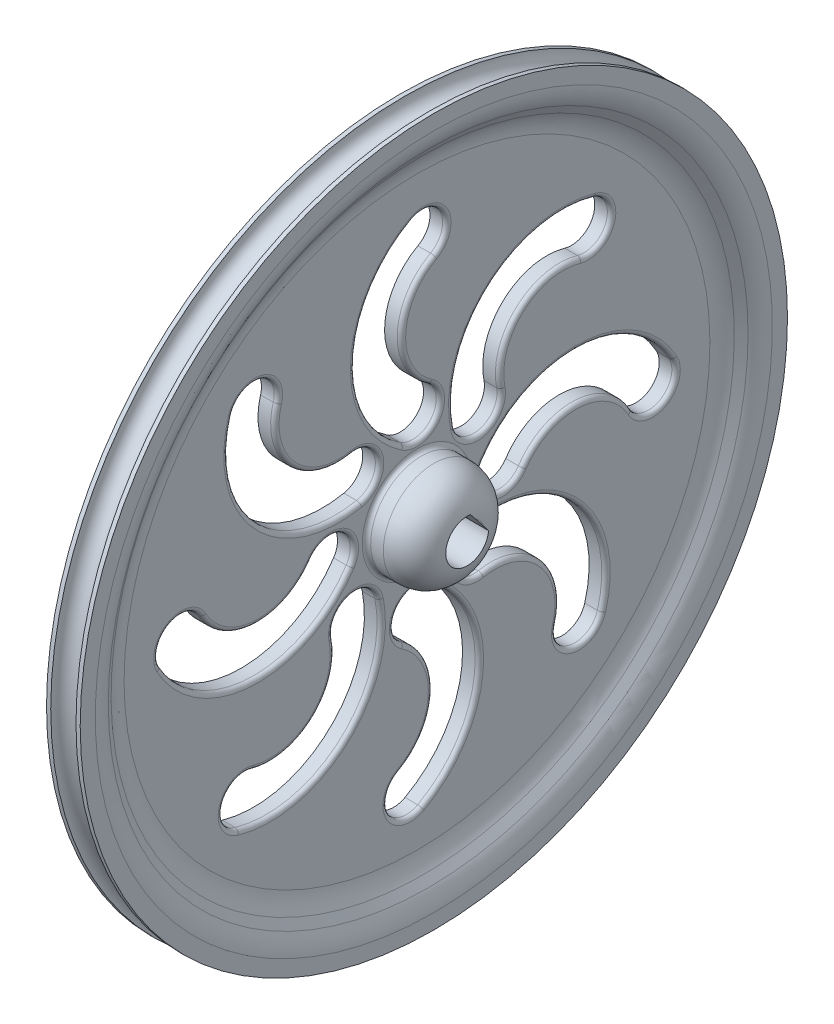
from build123d import *

# Parameters (mm, degrees)
WYTNIJ_WYCI_GNI_CIE8_DEPTH = 70.489061928
WYTNIJ_WYCI_GNI_CIE9_DEPTH = 70.287298459
ZAOKR_GLENIE1_R            = 4
ZAOKR_GLENIE2_R            = 0.5


with BuildPart() as part:
    # Szkic1 → Obrót1 (revolve)
    with BuildSketch(Plane.XY):
        with BuildLine():
            Line((6, -12.778916817), (-2, -12.778916817))
            Line((-2, -12.778916817), (-2, 29.221083183))
            Line((-2, 29.221083183), (-1.5, 29.221083183))
            ThreePointArc((-1.5, 29.221083183), (0, 27.721083183), (1.5, 29.221083183))
            Line((1.5, 29.221083183), (2, 29.221083183))
            Line((2, 29.221083183), (2, 27.432185734))
            ThreePointArc((2, 27.432185734), (1.828368106, 26.273049139), (1.328201177, 25.213384949))
            Line((1.328201177, 25.213384949), (0.671798823, 24.228781417))
            ThreePointArc((0.671798823, 24.228781417), (0.171631894, 23.169117227), (0, 22.009980632))
            Line((0, 22.009980632), (0, -6.778916817))
            Line((0, -6.778916817), (6, -6.778916817))
            Line((6, -6.778916817), (6, -12.778916817))
        make_face()
    revolve(axis=Axis((6, -12.778916817, 0), (-1, 0, 0)))

    # Szkic4 → Wytnij-wyciągnięcie8 (cut, through all)
    with BuildSketch(Plane(origin=(6, 0, 0), x_dir=(0, 0, -1), z_dir=(1, 0, 0))):
        with BuildLine():
            Line((0.380948258, -10.257532589), (2.541219296, -12.990351177))
            ThreePointArc((2.541219296, -12.990351177), (-2.000459988, -14.360264293), (0.380948258, -10.257532589))
        make_face()
    extrude(amount=-WYTNIJ_WYCI_GNI_CIE8_DEPTH, mode=Mode.SUBTRACT)

    # Szkic5 → Wytnij-wyciągnięcie9 (cut, through all)
    with BuildSketch(Plane(origin=(0, 0, 0), x_dir=(0, 0, -1), z_dir=(1, 0, 0))):
        with BuildLine():
            ThreePointArc((-0.575720008, 17.423189035), (-7.399578746, 6.437179505), (-1.542690175, -5.093401996))
            ThreePointArc((-1.542690175, -5.093401996), (2.314485179, -4.321606992), (1.542690175, -0.464431639))
            ThreePointArc((1.542690175, -0.464431639), (-1.841704197, 6.198497775), (2.101452451, 12.546747084))
            ThreePointArc((2.101452451, 12.546747084), (3.201087197, 16.323554289), (-0.575720008, 17.423189035))
        make_face()
        with BuildLine():
            ThreePointArc((21.10534775, 8.919538793), (8.511869125, 5.976453744), (4.499962381, -6.318344251))
            ThreePointArc((4.499962381, -6.318344251), (7.77313871, -8.500037619), (9.954832078, -5.22686129))
            ThreePointArc((9.954832078, -5.22686129), (12.273106439, 1.877669493), (19.550229379, 3.578326822))
            ThreePointArc((19.550229379, 3.578326822), (22.99839455, 5.471373622), (21.10534775, 8.919538793))
        make_face()
        with BuildLine():
            ThreePointArc((30.423189035, -12.424279992), (19.437179505, -5.600421254), (7.906598004, -11.457309825))
            ThreePointArc((7.906598004, -11.457309825), (8.678393008, -15.314485179), (12.535568361, -14.542690175))
            ThreePointArc((12.535568361, -14.542690175), (19.198497775, -11.158295803), (25.546747084, -15.101452451))
            ThreePointArc((25.546747084, -15.101452451), (29.323554289, -16.201087197), (30.423189035, -12.424279992))
        make_face()
        with BuildLine():
            ThreePointArc((21.919538793, -34.10534775), (18.976453744, -21.511869125), (6.681655749, -17.499962381))
            ThreePointArc((6.681655749, -17.499962381), (4.499962381, -20.77313871), (7.77313871, -22.954832078))
            ThreePointArc((7.77313871, -22.954832078), (14.877669493, -25.273106439), (16.578326822, -32.550229379))
            ThreePointArc((16.578326822, -32.550229379), (18.471373622, -35.99839455), (21.919538793, -34.10534775))
        make_face()
        with BuildLine():
            ThreePointArc((0.575720008, -43.423189035), (7.399578746, -32.437179505), (1.542690175, -20.906598004))
            ThreePointArc((1.542690175, -20.906598004), (-2.314485179, -21.678393008), (-1.542690175, -25.535568361))
            ThreePointArc((-1.542690175, -25.535568361), (1.841704197, -32.198497775), (-2.101452451, -38.546747084))
            ThreePointArc((-2.101452451, -38.546747084), (-3.201087197, -42.323554289), (0.575720008, -43.423189035))
        make_face()
        with BuildLine():
            ThreePointArc((-21.10534775, -34.919538793), (-8.511869125, -31.976453744), (-4.499962381, -19.681655749))
            ThreePointArc((-4.499962381, -19.681655749), (-7.77313871, -17.499962381), (-9.954832078, -20.77313871))
            ThreePointArc((-9.954832078, -20.77313871), (-12.273106439, -27.877669493), (-19.550229379, -29.578326822))
            ThreePointArc((-19.550229379, -29.578326822), (-22.99839455, -31.471373622), (-21.10534775, -34.919538793))
        make_face()
        with BuildLine():
            ThreePointArc((-30.423189035, -13.575720008), (-19.437179505, -20.399578746), (-7.906598004, -14.542690175))
            ThreePointArc((-7.906598004, -14.542690175), (-8.678393008, -10.685514821), (-12.535568361, -11.457309825))
            ThreePointArc((-12.535568361, -11.457309825), (-19.198497775, -14.841704197), (-25.546747084, -10.898547549))
            ThreePointArc((-25.546747084, -10.898547549), (-29.323554289, -9.798912803), (-30.423189035, -13.575720008))
        make_face()
        with BuildLine():
            ThreePointArc((-21.919538793, 8.10534775), (-18.976453744, -4.488130875), (-6.681655749, -8.500037619))
            ThreePointArc((-6.681655749, -8.500037619), (-4.499962381, -5.22686129), (-7.77313871, -3.045167922))
            ThreePointArc((-7.77313871, -3.045167922), (-14.877669493, -0.726893561), (-16.578326822, 6.550229379))
            ThreePointArc((-16.578326822, 6.550229379), (-18.471373622, 9.99839455), (-21.919538793, 8.10534775))
        make_face()
    extrude(amount=-WYTNIJ_WYCI_GNI_CIE9_DEPTH, mode=Mode.SUBTRACT)

    # Zaokrąglenie1
    # the kernel refuses this fillet: 4 mm, written as the material it takes off along each edge
    with BuildSketch(Plane(origin=(6, -12.778916817, 0), x_dir=(0, 1, 0), z_dir=(0, 0, 1))) as zaokr_glenie1_piece_1:
        with BuildLine():
            CenterArc((6 - ZAOKR_GLENIE1_R, ZAOKR_GLENIE1_R), ZAOKR_GLENIE1_R, 270, 90)
            Line((6, ZAOKR_GLENIE1_R), (6, 0))
            Line((6, 0), (6 - ZAOKR_GLENIE1_R, 0))
        make_face()
    revolve(axis=Axis((6, -12.778916817, 0), (-1, 0, 0)), mode=Mode.SUBTRACT)

    # Zaokrąglenie2
    zaokr_glenie2_edges = [part.edges().sort_by_distance(p)[0] for p in [
        (0, -31.471373622, 22.99839455),
        (0, -31.976453744, 8.511869125),
        (0, -17.499962381, 7.77313871),
        (0, -27.877669493, 12.273106439),
        (0, -9.798912803, 29.323554289),
        (0, -20.399578746, 19.437179505),
        (0, -10.685514821, 8.678393008),
        (0, -14.841704197, 19.198497775),
        (0, 9.99839455, 18.471373622),
        (0, -4.488130875, 18.976453744),
        (0, -5.22686129, 4.499962381),
        (0, -0.726893561, 14.877669493),
        (0, 16.323554289, -3.201087197),
        (0, 6.437179505, 7.399578746),
        (0, -4.321606992, -2.314485179),
        (0, 6.198497775, 1.841704197),
        (0, 5.471373622, -22.99839455),
        (0, 5.976453744, -8.511869125),
        (0, -8.500037619, -7.77313871),
        (0, 1.877669493, -12.273106439),
        (0, -16.201087197, -29.323554289),
        (0, -5.600421254, -19.437179505),
        (0, -15.314485179, -8.678393008),
        (0, -11.158295803, -19.198497775),
        (0, -35.99839455, -18.471373622),
        (0, -21.511869125, -18.976453744),
        (0, -20.77313871, -4.499962381),
        (0, -25.273106439, -14.877669493),
        (0, -18.778916817, 0),
        (0, -42.323554289, 3.201087197),
        (0, -32.437179505, -7.399578746),
        (0, -21.678393008, 2.314485179),
        (0, -32.198497775, -1.841704197),
    ]]
    fillet(zaokr_glenie2_edges, radius=ZAOKR_GLENIE2_R)


solid = part.part
